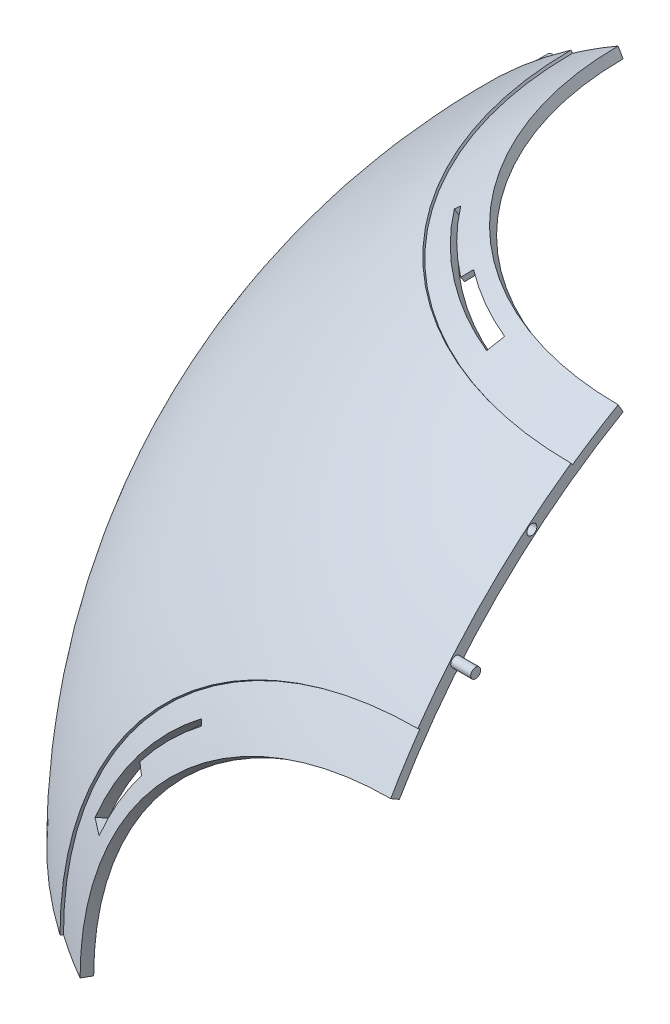
from build123d import *

# Parameters (mm, degrees)
REVOLVE1_ANGLE      = 90
SKETCH4_R           = 2
BOSS_EXTRUDE1_DEPTH = 8
SKETCH4_4_R         = 2.025
CUT_EXTRUDE2_DEPTH  = 8
SKETCH5_R           = 2
BOSS_EXTRUDE2_DEPTH = 8
SKETCH5_3_R         = 2.025
CUT_EXTRUDE3_DEPTH  = 8
SKETCH6_R           = 2.025
CUT_EXTRUDE4_DEPTH  = 8
SKETCH6_4_R         = 2
BOSS_EXTRUDE3_DEPTH = 8
CUT_REVOLVE4_ANGLE  = 15
CUT_REVOLVE5_ANGLE  = 15
CIRPATTERN5_COUNT   = 3


with BuildPart() as part:
    # Sketch1 → Revolve1 (revolve)
    with BuildSketch(Plane.XY):
        with BuildLine():
            ThreePointArc((-245, 0), (-212.176223927, 122.5), (-122.5, 212.176223927))
            Line((-122.5, 212.176223927), (-124.5, 215.640325542))
            ThreePointArc((-124.5, 215.640325542), (-133.787602478, 210.004470007), (-142.820532651, 203.968859028))
            Line((-142.820532651, 203.968859028), (-143.394109088, 204.788011072))
            ThreePointArc((-143.394109088, 204.788011072), (-221.752708295, 115.437153309), (-250, 0))
            Line((-250, 0), (-245, 0))
        make_face()
    revolve(axis=Axis((0, 0, 0), (0, 1, 0)), revolution_arc=REVOLVE1_ANGLE)

    # Sketch2 → Cut-Revolve2 (revolve, cut)
    with BuildSketch(Plane(origin=(0, 0, 0), x_dir=(0, 0, -1), z_dir=(1, 0, 0))):
        with BuildLine():
            Line((-250, 0), (-245, 0))
            ThreePointArc((-245, 0), (-236.651827441, 63.41066605), (-212.176223927, 122.5))
            Line((-212.176223927, 122.5), (-215.640325542, 124.5))
            ThreePointArc((-215.640325542, 124.5), (-210.004470007, 133.787602478), (-203.968859028, 142.820532651))
            Line((-203.968859028, 142.820532651), (-204.788011072, 143.394109088))
            ThreePointArc((-204.788011072, 143.394109088), (-238.429237687, 75.176449876), (-250, 0))
        make_face()
    revolve(axis=Axis((0, 0, 0), (0, 0, 1)), mode=Mode.SUBTRACT)

    # Sketch3 → Cut-Revolve3 (revolve, cut)
    with BuildSketch(Plane(origin=(0, 0, 0), x_dir=(-1, 0, 0), z_dir=(0, 0, -1))):
        with BuildLine():
            ThreePointArc((212.176223927, 122.5), (236.651827441, 63.41066605), (245, 0))
            Line((245, 0), (250, 0))
            ThreePointArc((250, 0), (238.429237687, 75.176449876), (204.788011072, 143.394109088))
            Line((204.788011072, 143.394109088), (203.968859028, 142.820532651))
            ThreePointArc((203.968859028, 142.820532651), (210.004470007, 133.787602478), (215.640325542, 124.5))
            Line((215.640325542, 124.5), (212.176223927, 122.5))
        make_face()
    revolve(axis=Axis((0, 0, 0), (-1, 0, 0)), mode=Mode.SUBTRACT)

    # Sketch4 → Boss-Extrude1 (add)
    with BuildSketch(Plane(origin=(0, 0, 0), x_dir=(-1, 0, 0), z_dir=(0, 0, -1))):
        with Locations((159.089933397, 189.595999672)):
            Circle(SKETCH4_R)
    extrude(amount=BOSS_EXTRUDE1_DEPTH)

    # Sketch4<4> → Cut-Extrude2 (cut)
    with BuildSketch(Plane(origin=(0, 0, 0), x_dir=(-1, 0, 0), z_dir=(0, 0, -1))):
        with Locations((189.595999672, 159.089933397)):
            Circle(SKETCH4_4_R)
    extrude(amount=-CUT_EXTRUDE2_DEPTH, mode=Mode.SUBTRACT)

    # Sketch5 → Boss-Extrude2 (add)
    with BuildSketch(Plane(origin=(0, 0, 0), x_dir=(0, 0, -1), z_dir=(1, 0, 0))):
        with Locations((-189.595999672, 159.089933397)):
            Circle(SKETCH5_R)
    extrude(amount=BOSS_EXTRUDE2_DEPTH)

    # Sketch5<3> → Cut-Extrude3 (cut)
    with BuildSketch(Plane(origin=(0, 0, 0), x_dir=(0, 0, -1), z_dir=(1, 0, 0))):
        with Locations((-159.089933397, 189.595999672)):
            Circle(SKETCH5_3_R)
    extrude(amount=-CUT_EXTRUDE3_DEPTH, mode=Mode.SUBTRACT)

    # Sketch6 → Cut-Extrude4 (cut)
    with BuildSketch(Plane.XZ):
        with Locations((-159.089933397, 189.595999672)):
            Circle(SKETCH6_R)
    extrude(amount=-CUT_EXTRUDE4_DEPTH, mode=Mode.SUBTRACT)

    # Sketch6<4> → Boss-Extrude3 (add)
    with BuildSketch(Plane.XZ):
        with Locations((-189.595999672, 159.089933397)):
            Circle(SKETCH6_4_R)
    extrude(amount=BOSS_EXTRUDE3_DEPTH)

    # Sketch11 → Cut-Revolve4 (revolve, cut)
    with BuildSketch(Plane(origin=(0, 0, 0), x_dir=(-1, 0, 0), z_dir=(0, -0.3826834323650906, 0.9238795325112865))):
        with BuildLine():
            Line((212.307400924, -130.102142614), (208.896840267, -128.012148355))
            ThreePointArc((208.896840267, -128.012148355), (207.203316317, -130.735556399), (205.474289147, -133.436563579))
            Line((205.474289147, -133.436563579), (208.828971418, -135.615119719))
            ThreePointArc((208.828971418, -135.615119719), (210.586227604, -132.870014463), (212.307400924, -130.102142614))
        make_face()
    cut_revolve4 = revolve(axis=Axis((0, 0, 0), (1, 0, 0)), revolution_arc=CUT_REVOLVE4_ANGLE, mode=Mode.SUBTRACT)

    # Sketch12 → Cut-Revolve5 (revolve, cut)
    with BuildSketch(Plane(origin=(0, 0, 0), x_dir=(1, 0, 0), z_dir=(0, 0.6087614290087219, -0.7933533402912343))):
        with BuildLine():
            ThreePointArc((-205.474289147, -133.436563579), (-207.203316317, -130.735556399), (-208.896840267, -128.012148355))
            Line((-208.896840267, -128.012148355), (-210.602120595, -129.057145485))
            ThreePointArc((-210.602120595, -129.057145485), (-209.467879751, -130.890058266), (-208.317687116, -132.713003262))
            Line((-208.317687116, -132.713003262), (-210.004470007, -133.787602478))
            ThreePointArc((-210.004470007, -133.787602478), (-209.418714228, -134.702643371), (-208.828971418, -135.615119719))
            Line((-208.828971418, -135.615119719), (-205.474289147, -133.436563579))
        make_face()
    cut_revolve5 = revolve(axis=Axis((0, 0, 0), (1, 0, 0)), revolution_arc=CUT_REVOLVE5_ANGLE, mode=Mode.SUBTRACT)

    # CirPattern5: Cut-Revolve4, Cut-Revolve5 ×3 about axis
    cirpattern5_axis = Axis((9.468761978, -9.468761978, -9.468761978), (-0.5773502691896264, 0.5773502691896245, 0.5773502691896264))
    add([cut_revolve4.rotate(cirpattern5_axis, i * 360 / CIRPATTERN5_COUNT) for i in range(1, CIRPATTERN5_COUNT)], mode=Mode.SUBTRACT)
    add([cut_revolve5.rotate(cirpattern5_axis, i * 360 / CIRPATTERN5_COUNT) for i in range(1, CIRPATTERN5_COUNT)], mode=Mode.SUBTRACT)


solid = part.part
